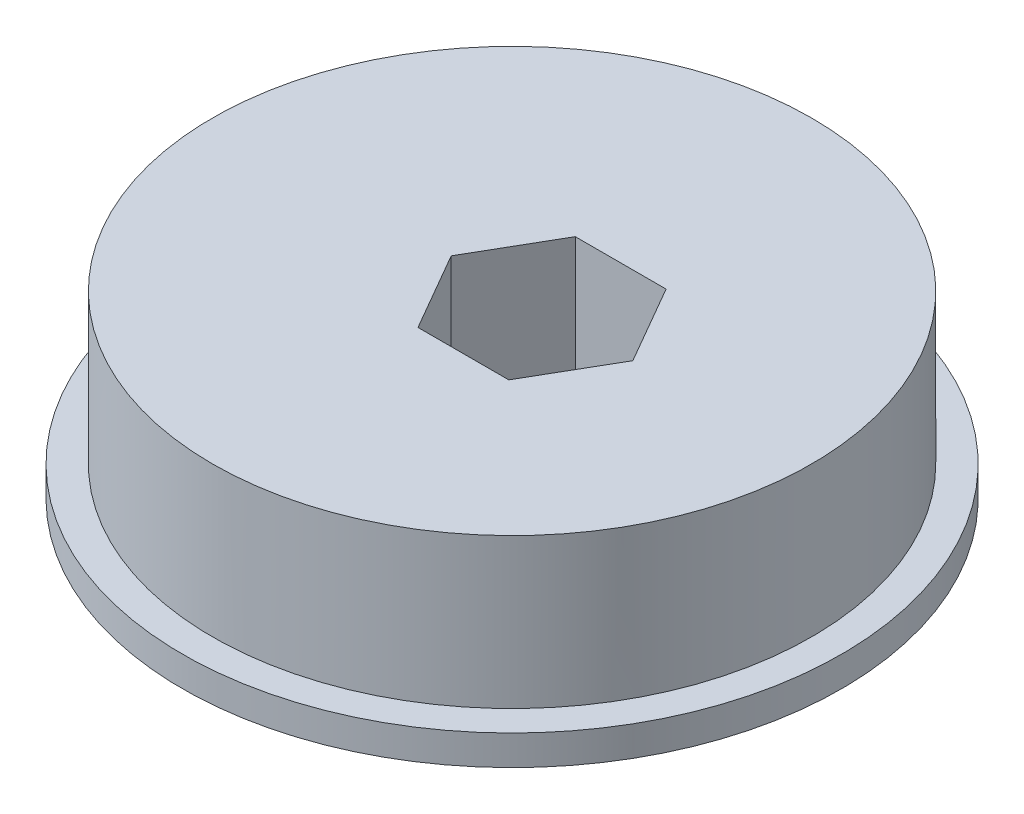
from build123d import *

# Parameters (mm, degrees)
SKETCH1_R           = 10
BOSS_EXTRUDE1_DEPTH = 6
SKETCH2_R           = 11
BOSS_EXTRUDE2_DEPTH = 1
CUT_EXTRUDE1_DEPTH  = 18.349351573


with BuildPart() as part:
    # Sketch1 → Boss-Extrude1 (new body)
    with BuildSketch(Plane(origin=(0, 0, 0), x_dir=(1, 0, 0), z_dir=(0, 1, 0))):
        with Locations((-1, 0)):
            Circle(SKETCH1_R)
    extrude(amount=BOSS_EXTRUDE1_DEPTH)

    # Sketch2 → Boss-Extrude2 (add)
    with BuildSketch(Plane.XZ):
        with Locations((-1, 0)):
            Circle(SKETCH2_R)
    extrude(amount=-BOSS_EXTRUDE2_DEPTH)

    # Sketch4 → Cut-Extrude1 (cut, through all)
    with BuildSketch(Plane(origin=(0, 6, 0), x_dir=(1, 0, 0), z_dir=(0, 1, 0))):
        Polygon((3.031088913, 0), (1.515544457, 2.625), (-1.515544457, 2.625), (-3.031088913, 0), (-1.515544457, -2.625), (1.515544457, -2.625), align=None)
    extrude(amount=-CUT_EXTRUDE1_DEPTH, mode=Mode.SUBTRACT)


solid = part.part
